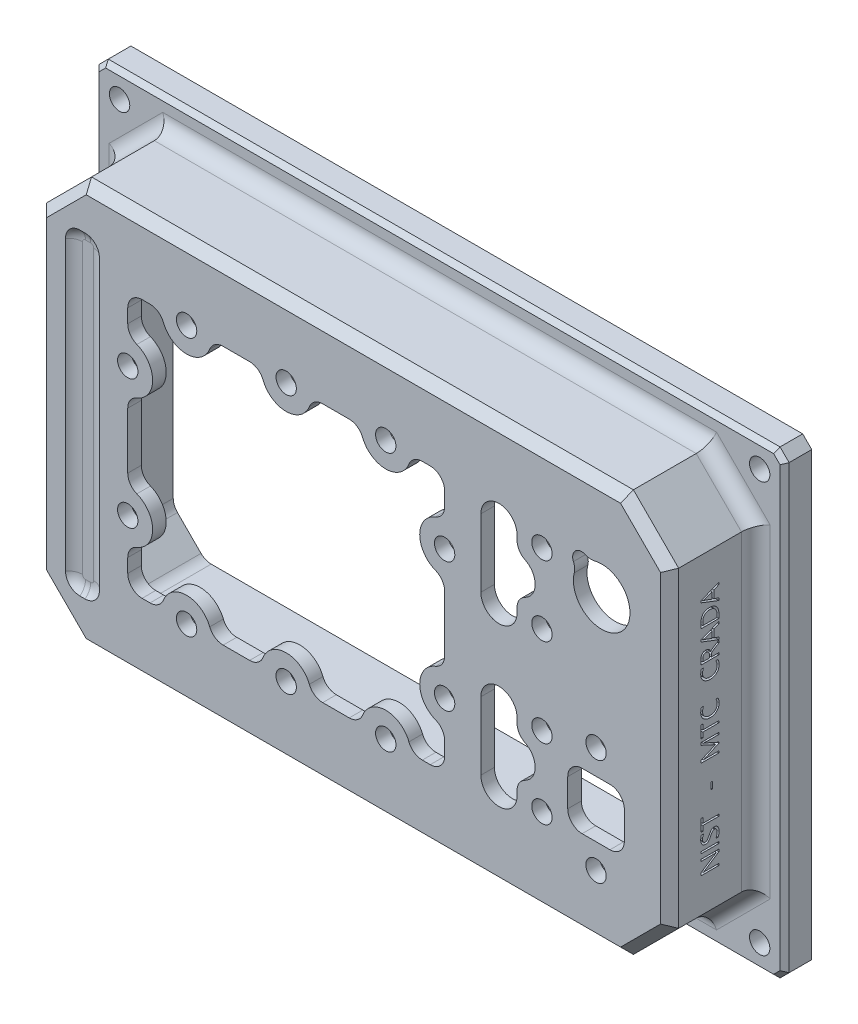
from build123d import *

# Parameters (mm, degrees)
SKETCH1_W                            = 152.4
SKETCH1_H                            = 101.6
FLANGE_BASE_DEPTH                    = 6
COVER_EXTERIOR_DEPTH                 = 19.05
F_4X_CLEARANCE_HOLE_M4_FLANGE_D      = 4.5
COVER_INTERIOR_DEPTH                 = 22.05
WINDOW_COVER_DEPTH                   = 185.867040059
F_10X_CLEARANCE_HOLE_M4_WINDOW_D     = 4.5
SKETCH8_W                            = 7.5
SKETCH8_H                            = 70
GROOVE_TOP_COVER_DEPTH               = 1.25
SKETCH9_W                            = 12.5
SKETCH9_H                            = 12.5
PORTS_TOP_COVER_DEPTH                = 185.867040059
F_2X_CLEARANCE_HOLE_M4_PORT_SQUARE_D = 4.5
F_4X_CLEARANCE_HOLE_M4_PORT_SLOTS_D  = 4.5
FILLET_3_175MM_FLANGE_R              = 3.175
FILLET_3_175MM_WINDOW_R              = 3.175
FILLET_3_175MM_PORTS_R               = 3.175
FILLET_3_175MM_GROOVE_R              = 3.175
FILLET_3MM_COVER_INTERIOR_R          = 3.175
CHAMFER_2MM_SIZE                     = 2
CHAMFER_1MM_SIZE                     = 1
SKETCH13_W                           = 3.950146484
SKETCH13_H                           = 0.40514323
SKETCH13_W_2                         = 0.354500326
SKETCH13_H_2                         = 1.468644205
ENGRAVING_TEXT_DEPTH                 = 1.5


with BuildPart() as part:
    # Sketch1 → Flange, Base (new body)
    with BuildSketch(Plane.XY):
        with Locations((76.2, 50.8)):
            Rectangle(SKETCH1_W, SKETCH1_H)
    extrude(amount=FLANGE_BASE_DEPTH)

    # Sketch2 → Cover, Exterior (add)
    with BuildSketch(Plane.XY.offset(6)):
        Polygon((16.35, 95.25), (6.35, 85.25), (6.35, 16.35), (16.35, 6.35), (136.05, 6.35), (146.05, 16.35), (146.05, 85.25), (136.05, 95.25), align=None)
    extrude(amount=COVER_EXTERIOR_DEPTH)

    # 4X, Clearance Hole, M4, Flange (through all)
    with Locations(Plane.XY.offset(6)):
        with Locations((146.9, 5.5), (5.5, 5.5), (5.5, 96.1), (146.9, 96.1)):
            Hole(F_4X_CLEARANCE_HOLE_M4_FLANGE_D / 2)

    # Sketch5 → Cover, Interior (cut)
    with BuildSketch(Plane(origin=(0, 0, 0), x_dir=(-1, 0, 0), z_dir=(0, 0, -1))):
        Polygon((-11.35, 83.178932188), (-18.421067812, 90.25), (-133.978932188, 90.25), (-141.05, 83.178932188), (-141.05, 18.421067812), (-133.978932188, 11.35), (-18.421067812, 11.35), (-11.35, 18.421067812), align=None)
    extrude(amount=-COVER_INTERIOR_DEPTH, mode=Mode.SUBTRACT)

    # Sketch6 → Window, Cover (cut, through all)
    with BuildSketch(Plane.XY.offset(25.05)):
        with BuildLine():
            Line((26.35, 79.375), (33.85, 79.375))
            ThreePointArc((33.85, 79.375), (39.35, 73.875), (44.85, 79.375))
            Line((44.85, 79.375), (55.85, 79.375))
            ThreePointArc((55.85, 79.375), (61.35, 73.875), (66.85, 79.375))
            Line((66.85, 79.375), (77.85, 79.375))
            ThreePointArc((77.85, 79.375), (83.35, 73.875), (88.85, 79.375))
            Line((88.85, 79.375), (96.35, 79.375))
            Line((96.35, 79.375), (96.35, 70.5875))
            ThreePointArc((96.35, 70.5875), (90.85, 65.0875), (96.35, 59.5875))
            Line((96.35, 59.5875), (96.35, 42.0125))
            ThreePointArc((96.35, 42.0125), (90.85, 36.5125), (96.35, 31.0125))
            Line((96.35, 31.0125), (96.35, 22.225))
            Line((96.35, 22.225), (88.85, 22.225))
            ThreePointArc((88.85, 22.225), (83.35, 27.725), (77.85, 22.225))
            Line((77.85, 22.225), (66.85, 22.225))
            ThreePointArc((66.85, 22.225), (61.35, 27.725), (55.85, 22.225))
            Line((55.85, 22.225), (44.85, 22.225))
            ThreePointArc((44.85, 22.225), (39.35, 27.725), (33.85, 22.225))
            Line((33.85, 22.225), (26.35, 22.225))
            Line((26.35, 22.225), (26.35, 31.0125))
            ThreePointArc((26.35, 31.0125), (31.85, 36.5125), (26.35, 42.0125))
            Line((26.35, 42.0125), (26.35, 59.5875))
            ThreePointArc((26.35, 59.5875), (31.85, 65.0875), (26.35, 70.5875))
            Line((26.35, 70.5875), (26.35, 79.375))
        make_face()
    extrude(amount=-WINDOW_COVER_DEPTH, mode=Mode.SUBTRACT)

    # 10X, Clearance Hole, M4, Window (through all)
    with Locations(Plane(origin=(39.35, 22.225, 25.05), x_dir=(1, 0, 0), z_dir=(0, 0, 1))):
        with Locations((0, 0), (22, 0), (44, 0), (57, 14.2875), (57, 42.8625), (44, 57.15), (22, 57.15), (0, 57.15), (-13, 42.8625), (-13, 14.2875)):
            Hole(F_10X_CLEARANCE_HOLE_M4_WINDOW_D / 2)

    # Sketch8 → Groove, Top, Cover (cut)
    with BuildSketch(Plane.XY.offset(25.05)):
        with Locations((16.35, 50.8)):
            Rectangle(SKETCH8_W, SKETCH8_H)
    extrude(amount=-GROOVE_TOP_COVER_DEPTH, mode=Mode.SUBTRACT)

    # Sketch9 → Ports, Top, Cover (cut, through all)
    with BuildSketch(Plane.XY.offset(25.05)):
        with BuildLine():
            Line((112.35, 29.3), (112.35, 25.8))
            ThreePointArc((112.35, 25.8), (108.35, 21.8), (104.35, 25.8))
            Line((104.35, 25.8), (104.35, 40.8))
            ThreePointArc((104.35, 40.8), (108.35, 44.8), (112.35, 40.8))
            Line((112.35, 40.8), (112.35, 37.3))
            ThreePointArc((112.35, 37.3), (116.35, 33.3), (112.35, 29.3))
        make_face()
        with Locations((129.8, 32.05)):
            Rectangle(SKETCH9_W, SKETCH9_H)
        with BuildLine():
            Line((112.35, 75.8), (112.35, 72.3))
            ThreePointArc((112.35, 72.3), (116.35, 68.3), (112.35, 64.3))
            Line((112.35, 64.3), (112.35, 60.8))
            ThreePointArc((112.35, 60.8), (108.35, 56.8), (104.35, 60.8))
            Line((104.35, 60.8), (104.35, 75.8))
            ThreePointArc((104.35, 75.8), (108.35, 79.8), (112.35, 75.8))
        make_face()
        with BuildLine():
            ThreePointArc((125.460862518, 76.097148943), (135.469417382, 68.880582618), (128.252851057, 78.889137482))
            ThreePointArc((128.252851057, 78.889137482), (125.216369055, 79.133630945), (125.460862518, 76.097148943))
        make_face()
    extrude(amount=-PORTS_TOP_COVER_DEPTH, mode=Mode.SUBTRACT)

    # 2X, Clearance Hole, M4, Port, Square (through all)
    with Locations(Plane(origin=(129.8, 43.8, 25.05), x_dir=(1, 0, 0), z_dir=(0, 0, 1))):
        with Locations((0, 0), (0, -23.5)):
            Hole(F_2X_CLEARANCE_HOLE_M4_PORT_SQUARE_D / 2)

    # 4X, Clearance Hole, M4, Port, Slots (through all)
    with Locations(Plane(origin=(117.85, 76.045966692, 25.05), x_dir=(1, 0, 0), z_dir=(0, 0, 1))):
        with Locations((0, 0), (0, -15.491933384), (0, -35), (0, -50.491933384)):
            Hole(F_4X_CLEARANCE_HOLE_M4_PORT_SLOTS_D / 2)

    # Fillet, 3.175mm, Flange
    fillet_3_175mm_flange_edges = [part.edges().sort_by_distance(p)[0] for p in [
        (6.35, 50.8, 6),
        (11.35, 11.35, 6),
        (76.2, 6.35, 6),
        (141.05, 11.35, 6),
        (146.05, 50.8, 6),
        (141.05, 90.25, 6),
        (76.2, 95.25, 6),
        (11.35, 90.25, 6),
    ]]
    fillet(fillet_3_175mm_flange_edges, radius=FILLET_3_175MM_FLANGE_R)

    # Fillet, 3.175mm, Window
    fillet_3_175mm_window_edges = [part.edges().sort_by_distance(p)[0] for p in [
        (26.35, 79.375, 23.55),
        (33.85, 79.375, 23.55),
        (44.85, 79.375, 23.55),
        (55.85, 79.375, 23.55),
        (66.85, 79.375, 23.55),
        (77.85, 79.375, 23.55),
        (88.85, 79.375, 23.55),
        (96.35, 79.375, 23.55),
        (96.35, 70.5875, 23.55),
        (96.35, 59.5875, 23.55),
        (96.35, 42.0125, 23.55),
        (96.35, 31.0125, 23.55),
        (96.35, 22.225, 23.55),
        (88.85, 22.225, 23.55),
        (77.85, 22.225, 23.55),
        (66.85, 22.225, 23.55),
        (55.85, 22.225, 23.55),
        (44.85, 22.225, 23.55),
        (33.85, 22.225, 23.55),
        (26.35, 22.225, 23.55),
        (26.35, 31.0125, 23.55),
        (26.35, 42.0125, 23.55),
        (26.35, 59.5875, 23.55),
        (26.35, 70.5875, 23.55),
    ]]
    fillet(fillet_3_175mm_window_edges, radius=FILLET_3_175MM_WINDOW_R)

    # Fillet, 3.175mm, Ports
    fillet_3_175mm_ports_edges = [part.edges().sort_by_distance(p)[0] for p in [
        (12.6, 15.8, 24.425),
        (12.6, 85.8, 24.425),
        (20.1, 85.8, 24.425),
        (20.1, 15.8, 24.425),
        (123.55, 25.8, 23.55),
        (123.55, 38.3, 23.55),
        (136.05, 38.3, 23.55),
        (136.05, 25.8, 23.55),
        (125.460862518, 76.097148943, 23.55),
        (128.252851057, 78.889137482, 23.55),
        (112.35, 37.3, 23.55),
        (112.35, 29.3, 23.55),
        (112.35, 72.3, 23.55),
        (112.35, 64.3, 23.55),
    ]]
    fillet(fillet_3_175mm_ports_edges, radius=FILLET_3_175MM_PORTS_R)

    # Fillet, 3.175mm, Groove
    # the kernel refuses this fillet: 3.175 mm, written as the material it adds along each edge
    with BuildSketch(Plane(origin=(15.775, 82.625, 23.8), x_dir=(-1, 0, 0), z_dir=(0, -1, 0))) as fillet_3_175mm_groove_piece_1:
        with BuildLine():
            CenterArc((0.650123765, -3.175), FILLET_3_175MM_GROOVE_R, 37.322390296, 52.677609704)
            Line((0.650123765, 0), (0.650123765, 0.0635))
            Line((0.650123765, 0.0635), (3.175, 0.0635))
            Line((3.175, 0.0635), (3.2385, 0))
            ThreePointArc((3.2385, 0), (3.2385, -0.625), (3.225497525, -1.2115))
            Line((3.225497525, -1.2115), (3.175, -1.25))
        make_face()
    revolve(axis=Axis((15.775, 82.625, 23.8), (0, 0, -1)), revolution_arc=90)
    with BuildSketch(Plane(origin=(15.775, 85.8, 23.8), x_dir=(0, 0, 1), z_dir=(1, 0, 0)), Plane(origin=(16.925, 15.8, 23.8), x_dir=(0, 0, 1), z_dir=(-1, 0, 0))) as fillet_3_175mm_groove_piece_2:
        with BuildLine():
            CenterArc((3.175, 2.524876235), FILLET_3_175MM_GROOVE_R, 180, 52.677609704)
            Line((0, 2.524876235), (-0.0635, 2.524876235))
            Line((-0.0635, 2.524876235), (-0.0635, 0))
            Line((-0.0635, 0), (0, -0.0635))
            ThreePointArc((0, -0.0635), (0.625, -0.0635), (1.2115, -0.050497525))
            Line((1.2115, -0.050497525), (1.25, 0))
        make_face()
    extrude(amount=1.15)
    with BuildSketch(Plane(origin=(16.925, 82.625, 23.8), x_dir=(0, 1, 0), z_dir=(-1, 0, 0))) as fillet_3_175mm_groove_piece_3:
        with BuildLine():
            CenterArc((0.650123765, -3.175), FILLET_3_175MM_GROOVE_R, 37.322390296, 52.677609704)
            Line((0.650123765, 0), (0.650123765, 0.0635))
            Line((0.650123765, 0.0635), (3.175, 0.0635))
            Line((3.175, 0.0635), (3.2385, 0))
            ThreePointArc((3.2385, 0), (3.2385, -0.625), (3.225497525, -1.2115))
            Line((3.225497525, -1.2115), (3.175, -1.25))
        make_face()
    revolve(axis=Axis((16.925, 82.625, 23.8), (0, 0, -1)), revolution_arc=90)
    with BuildSketch(Plane(origin=(20.1, 82.625, 23.8), x_dir=(0, 0, 1), z_dir=(0, -1, 0)), Plane(origin=(12.6, 18.975, 23.8), x_dir=(0, 0, 1), z_dir=(0, 1, 0))) as fillet_3_175mm_groove_piece_4:
        with BuildLine():
            CenterArc((3.175, 2.524876235), FILLET_3_175MM_GROOVE_R, 180, 52.677609704)
            Line((0, 2.524876235), (-0.0635, 2.524876235))
            Line((-0.0635, 2.524876235), (-0.0635, 0))
            Line((-0.0635, 0), (0, -0.0635))
            ThreePointArc((0, -0.0635), (0.625, -0.0635), (1.2115, -0.050497525))
            Line((1.2115, -0.050497525), (1.25, 0))
        make_face()
    extrude(amount=63.65)
    with BuildSketch(Plane(origin=(16.925, 18.975, 23.8), x_dir=(0, -1, 0), z_dir=(-1, 0, 0))) as fillet_3_175mm_groove_piece_5:
        with BuildLine():
            CenterArc((0.650123765, 3.175), FILLET_3_175MM_GROOVE_R, 270, 52.677609704)
            Line((0.650123765, 0), (0.650123765, -0.0635))
            Line((0.650123765, -0.0635), (3.175, -0.0635))
            Line((3.175, -0.0635), (3.2385, 0))
            ThreePointArc((3.2385, 0), (3.2385, 0.625), (3.225497525, 1.2115))
            Line((3.225497525, 1.2115), (3.175, 1.25))
        make_face()
    revolve(axis=Axis((16.925, 18.975, 23.8), (0, 0, 1)), revolution_arc=90)
    with BuildSketch(Plane(origin=(15.775, 18.975, 23.8), x_dir=(-1, 0, 0), z_dir=(0, 1, 0))) as fillet_3_175mm_groove_piece_6:
        with BuildLine():
            CenterArc((0.650123765, 3.175), FILLET_3_175MM_GROOVE_R, 270, 52.677609704)
            Line((0.650123765, 0), (0.650123765, -0.0635))
            Line((0.650123765, -0.0635), (3.175, -0.0635))
            Line((3.175, -0.0635), (3.2385, 0))
            ThreePointArc((3.2385, 0), (3.2385, 0.625), (3.225497525, 1.2115))
            Line((3.225497525, 1.2115), (3.175, 1.25))
        make_face()
    revolve(axis=Axis((15.775, 18.975, 23.8), (0, 0, 1)), revolution_arc=90)

    # Fillet, 3mm, Cover, Interior
    fillet_3mm_cover_interior_edges = [part.edges().sort_by_distance(p)[0] for p in [
        (14.885533906, 86.714466094, 22.05),
        (18.421067812, 90.25, 11.025),
        (76.2, 90.25, 22.05),
        (133.978932188, 90.25, 11.025),
        (137.514466094, 86.714466094, 22.05),
        (141.05, 83.178932188, 11.025),
        (141.05, 50.8, 22.05),
        (141.05, 18.421067812, 11.025),
        (137.514466094, 14.885533906, 22.05),
        (133.978932188, 11.35, 11.025),
        (76.2, 11.35, 22.05),
        (18.421067812, 11.35, 11.025),
        (14.885533906, 14.885533906, 22.05),
        (11.35, 18.421067812, 11.025),
        (11.35, 50.8, 22.05),
        (11.35, 83.178932188, 11.025),
    ]]
    fillet(fillet_3mm_cover_interior_edges, radius=FILLET_3MM_COVER_INTERIOR_R)

    # Chamfer, 2mm
    chamfer_2mm_edges = [part.edges().sort_by_distance(p)[0] for p in [
        (6.35, 50.8, 25.05),
        (11.35, 11.35, 25.05),
        (76.2, 6.35, 25.05),
        (141.05, 11.35, 25.05),
        (146.05, 50.8, 25.05),
        (141.05, 90.25, 25.05),
        (76.2, 95.25, 25.05),
        (11.35, 90.25, 25.05),
        (0, 101.6, 3),
        (152.4, 101.6, 3),
        (152.4, 0, 3),
        (0, 0, 3),
    ]]
    chamfer(chamfer_2mm_edges, length=CHAMFER_2MM_SIZE)

    # Chamfer, 1mm
    chamfer_1mm_edges = [part.edges().sort_by_distance(p)[0] for p in [
        (76.2, 101.6, 6),
        (152.4, 50.8, 6),
        (0, 50.8, 6),
        (76.2, 0, 6),
        (1, 100.6, 6),
        (1, 1, 6),
        (151.4, 1, 6),
        (151.4, 100.6, 6),
    ]]
    chamfer(chamfer_1mm_edges, length=CHAMFER_1MM_SIZE)

    # Sketch13 → Engraving, Text (cut)
    # profile 1 of 13: a face of its own
    with BuildSketch(Plane(origin=(146.05, 0, 0), x_dir=(0, 0, -1), z_dir=(1, 0, 0))):
        with BuildLine():
            Line((-14.175, 27.073799642), (-14.175, 26.564205424))
            Line((-14.175, 26.564205424), (-17.371041997, 24.464898809))
            add(Edge.make_bspline(
                [(-17.371041997, 24.464898809), (-17.388589714, 24.453870112), (-17.424929386, 24.431030718), (-17.48415208, 24.399685499), (-17.548669603, 24.367599326), (-17.594842121, 24.348802492), (-17.618717448, 24.339082845)],
                knots=[0, 0, 0, 0, 0.893627632, 1.850618776, 2.888577403, 4, 4, 4, 4], degree=3))
            Line((-17.618717448, 24.339082845), (-17.618717448, 24.325630824))
            add(Edge.make_bspline(
                [(-17.618717448, 24.325630824), (-17.604743432, 24.326773789), (-17.574449742, 24.329251578), (-17.52508303, 24.331264536), (-17.468377362, 24.333672764), (-17.40429263, 24.336190579), (-17.333066533, 24.337721066), (-17.254721138, 24.338227085), (-17.169000344, 24.339328483), (-17.10938741, 24.339167104), (-17.078262711, 24.339082845)],
                knots=[0, 0, 0, 0, 0.622216159, 1.348876676, 2.192485707, 3.141373248, 4.195230468, 5.354246407, 6.618617129, 8, 8, 8, 8], degree=3))
            Line((-17.078262711, 24.339082845), (-14.175, 24.339082845))
            Line((-14.175, 24.339082845), (-14.175, 23.933939616))
            Line((-14.175, 23.933939616), (-18.125146484, 23.933939616))
            Line((-18.125146484, 23.933939616), (-18.125146484, 24.491011556))
            Line((-18.125146484, 24.491011556), (-14.991616821, 26.527014542))
            add(Edge.make_bspline(
                [(-14.991616821, 26.527014542), (-14.974421848, 26.53801422), (-14.941820282, 26.558869543), (-14.896419664, 26.589601485), (-14.854936187, 26.614084573), (-14.820203772, 26.636952933), (-14.790392768, 26.654734651), (-14.766097706, 26.669162568), (-14.747818732, 26.680588919), (-14.736598389, 26.685618497), (-14.73207194, 26.687647502)],
                knots=[0, 0, 0, 0, 1.604255624, 3.041658944, 4.307369394, 5.388506731, 6.30929538, 7.034544353, 7.610521251, 8, 8, 8, 8], degree=3))
            Line((-14.73207194, 26.687647502), (-14.73207194, 26.697934341))
            add(Edge.make_bspline(
                [(-14.73207194, 26.697934341), (-14.749460073, 26.6953841), (-14.785991586, 26.690026181), (-14.843910572, 26.68526906), (-14.907646758, 26.679012669), (-14.977621476, 26.675618038), (-15.053582344, 26.67241163), (-15.135351728, 26.66979042), (-15.223204182, 26.669535525), (-15.28386917, 26.668956167), (-15.315256627, 26.668656413)],
                knots=[0, 0, 0, 0, 0.721552806, 1.515942873, 2.3858434, 3.351444354, 4.392253989, 5.508461052, 6.710902694, 8, 8, 8, 8], degree=3))
            Line((-15.315256627, 26.668656413), (-18.125146484, 26.668656413))
            Line((-18.125146484, 26.668656413), (-18.125146484, 27.073799642))
            Line((-18.125146484, 27.073799642), (-14.175, 27.073799642))
        make_face()
    # profile 2 of 13: a face of its own
    with BuildSketch(Plane(origin=(146.05, 0, 0), x_dir=(0, 0, -1), z_dir=(1, 0, 0))):
        with Locations((-16.150073242, 28.339872233)):
            Rectangle(SKETCH13_W, SKETCH13_H)
    # profile 3 of 13: a face of its own
    with BuildSketch(Plane(origin=(146.05, 0, 0), x_dir=(0, 0, -1), z_dir=(1, 0, 0))):
        with BuildLine():
            add(Edge.make_bspline(
                [(-14.833357747, 29.454016113), (-14.810933215, 29.486506579), (-14.763956114, 29.55457078), (-14.706896104, 29.670858063), (-14.655103932, 29.801833387), (-14.611654546, 29.944962869), (-14.576408554, 30.093102879), (-14.548526409, 30.238412452), (-14.533370374, 30.378452827), (-14.530770621, 30.469744721), (-14.529500326, 30.514351908)],
                knots=[0, 0, 0, 0, 0.846452964, 1.773232316, 2.77208296, 3.868154266, 4.980527569, 6.039981904, 7.042292891, 8, 8, 8, 8], degree=3))
            add(Edge.make_bspline(
                [(-14.529500326, 30.514351908), (-14.529932958, 30.54918075), (-14.530772967, 30.61680519), (-14.537884397, 30.714827501), (-14.549726722, 30.806238468), (-14.565751656, 30.891075443), (-14.588244435, 30.968648297), (-14.614108788, 31.039815038), (-14.645118857, 31.104206065), (-14.680413084, 31.162635859), (-14.72192519, 31.213220322), (-14.767510829, 31.25780775), (-14.818490315, 31.294678811), (-14.873592448, 31.326351419), (-14.93419142, 31.349963642), (-14.999385357, 31.366150421), (-15.069063692, 31.377055289), (-15.11712471, 31.377972455), (-15.141962941, 31.378446452)],
                knots=[0, 0, 0, 0, 1.387448694, 2.693900732, 3.912587258, 5.058421495, 6.129439662, 7.12689455, 8.071586665, 8.972727521, 9.839260954, 10.671605474, 11.506003778, 12.338878791, 13.197475128, 14.086960817, 15.011329513, 16, 16, 16, 16], degree=3))
            add(Edge.make_bspline(
                [(-15.141962941, 31.378446452), (-15.170552039, 31.377524481), (-15.226446856, 31.375721926), (-15.307439123, 31.357364203), (-15.383359626, 31.329073903), (-15.453190916, 31.288851535), (-15.517386169, 31.239754082), (-15.577811618, 31.184613888), (-15.63264508, 31.12143875), (-15.674480676, 31.062183057), (-15.709149177, 31.007601944), (-15.738849418, 30.956183992), (-15.772947416, 30.89487976), (-15.811636231, 30.824016627), (-15.854132814, 30.743038313), (-15.901963249, 30.652887814), (-15.953278615, 30.552322804), (-15.988449076, 30.481676885), (-16.00684878, 30.444717916)],
                knots=[0, 0, 0, 0, 1.01667817, 1.987717208, 2.942073005, 3.892862143, 4.845413119, 5.816043117, 6.801381151, 7.818059321, 8.396609255, 9.103907621, 9.93239023, 10.895032119, 11.979212488, 13.189395744, 14.529610242, 16, 16, 16, 16], degree=3))
            add(Edge.make_bspline(
                [(-16.00684878, 30.444717916), (-16.030104599, 30.400024383), (-16.075108536, 30.313534847), (-16.143829241, 30.19022682), (-16.211024945, 30.077308349), (-16.277553522, 29.97534392), (-16.341991202, 29.883362577), (-16.40555286, 29.802426137), (-16.466855116, 29.73138867), (-16.528627141, 29.671143412), (-16.591476259, 29.619284128), (-16.657156035, 29.574992684), (-16.726647106, 29.537103598), (-16.80043456, 29.507508848), (-16.877681039, 29.483516884), (-16.958664543, 29.46608937), (-17.043693702, 29.455577618), (-17.101707379, 29.454543333), (-17.1312795, 29.454016113)],
                knots=[0, 0, 0, 0, 1.518393315, 2.938347519, 4.253975348, 5.477722369, 6.60701253, 7.63752037, 8.578296998, 9.432795184, 10.234877336, 11.030829842, 11.816915694, 12.615563126, 13.422711235, 14.252216256, 15.109077795, 16, 16, 16, 16], degree=3))
            add(Edge.make_bspline(
                [(-17.1312795, 29.454016113), (-17.170376821, 29.455290455), (-17.247159552, 29.457793117), (-17.359301026, 29.475734419), (-17.464794333, 29.508148247), (-17.564140347, 29.551488717), (-17.657402834, 29.607695618), (-17.743571337, 29.677128499), (-17.824187678, 29.758474395), (-17.896862196, 29.851669512), (-17.962293599, 29.953524051), (-18.019228834, 30.06219342), (-18.067794261, 30.176742549), (-18.107211714, 30.2972403), (-18.138006173, 30.423440307), (-18.16035588, 30.55535747), (-18.172727788, 30.693210907), (-18.174756756, 30.787061707), (-18.175789388, 30.834826533)],
                knots=[0, 0, 0, 0, 0.969222899, 1.903444508, 2.805387991, 3.698421643, 4.584388408, 5.496374487, 6.43504833, 7.417526811, 8.420615585, 9.432680486, 10.455337492, 11.501700351, 12.572262804, 13.673113267, 14.815744348, 16, 16, 16, 16], degree=3))
            add(Edge.make_bspline(
                [(-18.175789388, 30.834826533), (-18.175368358, 30.882313824), (-18.174556193, 30.973916575), (-18.167407228, 31.106179531), (-18.155791191, 31.228193202), (-18.139475989, 31.339718103), (-18.11833649, 31.440779871), (-18.092259557, 31.531241786), (-18.062393289, 31.611831152), (-18.036269125, 31.659609925), (-18.023860677, 31.682303874)],
                knots=[0, 0, 0, 0, 1.310121745, 2.52721841, 3.653248466, 4.690686254, 5.635577584, 6.499266339, 7.287181937, 8, 8, 8, 8], degree=3))
            Line((-18.023860677, 31.682303874), (-17.517431641, 31.682303874))
            add(Edge.make_bspline(
                [(-17.517431641, 31.682303874), (-17.537839984, 31.652620387), (-17.579054471, 31.592674821), (-17.629910472, 31.494670833), (-17.673639074, 31.390689773), (-17.709311008, 31.280020993), (-17.736815731, 31.162758963), (-17.756392587, 31.038987208), (-17.768527478, 30.908659859), (-17.769928336, 30.819555405), (-17.770646159, 30.77389679)],
                knots=[0, 0, 0, 0, 0.901025016, 1.819612908, 2.757737419, 3.722440357, 4.726625466, 5.769822488, 6.857219657, 8, 8, 8, 8], degree=3))
            add(Edge.make_bspline(
                [(-17.770646159, 30.77389679), (-17.770326526, 30.742746795), (-17.769702404, 30.681922676), (-17.760861693, 30.593017325), (-17.750208557, 30.508115863), (-17.731142316, 30.428319918), (-17.709541667, 30.352359489), (-17.681498253, 30.281080749), (-17.649234219, 30.213743125), (-17.612360565, 30.151172619), (-17.5704618, 30.094904424), (-17.524356402, 30.045450377), (-17.474419138, 30.003039891), (-17.420270677, 29.968854026), (-17.362240552, 29.942289567), (-17.300540796, 29.9233895), (-17.234819073, 29.912135261), (-17.189879556, 29.910591869), (-17.166887792, 29.909802246)],
                knots=[0, 0, 0, 0, 1.266297591, 2.472598641, 3.631705049, 4.742959013, 5.805451407, 6.84139923, 7.853805457, 8.839952818, 9.790444434, 10.701239882, 11.584450425, 12.447560658, 13.297232265, 14.172721029, 15.065135306, 16, 16, 16, 16], degree=3))
            add(Edge.make_bspline(
                [(-17.166887792, 29.909802246), (-17.14602841, 29.910200522), (-17.104943387, 29.910984973), (-17.044970322, 29.918855832), (-16.988163674, 29.93272417), (-16.934088852, 29.950552213), (-16.883000685, 29.974730404), (-16.834885667, 30.003757216), (-16.78997194, 30.038470229), (-16.74681253, 30.079089545), (-16.704437752, 30.128988194), (-16.659330989, 30.188287272), (-16.612047684, 30.259578617), (-16.560712258, 30.341397337), (-16.507052405, 30.434935247), (-16.45105021, 30.540057581), (-16.390768859, 30.655797061), (-16.35111308, 30.737654227), (-16.330488586, 30.780227153)],
                knots=[0, 0, 0, 0, 0.77990353, 1.536112407, 2.256331255, 2.964490532, 3.661778373, 4.365595399, 5.062115187, 5.780913816, 6.578095787, 7.507405743, 8.566283842, 9.776155305, 11.119691656, 12.598303188, 14.230818451, 16, 16, 16, 16], degree=3))
            add(Edge.make_bspline(
                [(-16.330488586, 30.780227153), (-16.305396178, 30.829931475), (-16.256899793, 30.925995586), (-16.183105353, 31.062937508), (-16.109231477, 31.186439727), (-16.037577556, 31.297785588), (-15.966104758, 31.396192895), (-15.89635756, 31.482794372), (-15.826576668, 31.555942119), (-15.757573103, 31.617158271), (-15.688200775, 31.66860834), (-15.618150086, 31.712930722), (-15.546487037, 31.749989361), (-15.474257649, 31.781970445), (-15.399502465, 31.803939278), (-15.32413714, 31.822070621), (-15.246975265, 31.832572361), (-15.195009808, 31.833676908), (-15.168866984, 31.834232585)],
                knots=[0, 0, 0, 0, 1.609612237, 3.110915983, 4.495779321, 5.768997548, 6.937314625, 8.010323223, 8.981086609, 9.856220565, 10.673642867, 11.475445225, 12.249651958, 13.004580809, 13.7546806, 14.498240735, 15.244493736, 16, 16, 16, 16], degree=3))
            add(Edge.make_bspline(
                [(-15.168866984, 31.834232585), (-15.127920237, 31.833281482), (-15.048008594, 31.831425311), (-14.931706582, 31.813675962), (-14.822918044, 31.784412665), (-14.720909325, 31.744156898), (-14.627629436, 31.690459757), (-14.540567699, 31.62671969), (-14.462365543, 31.549880968), (-14.39095832, 31.462600433), (-14.327899286, 31.365044079), (-14.27287667, 31.2582865), (-14.22763972, 31.142400447), (-14.189123942, 31.01824335), (-14.160402952, 30.884711369), (-14.139162069, 30.742542974), (-14.126284111, 30.591345506), (-14.125011734, 30.487737438), (-14.124357096, 30.434431076)],
                knots=[0, 0, 0, 0, 0.994507712, 1.940880566, 2.850463274, 3.727671945, 4.597425683, 5.458897333, 6.342801193, 7.253783017, 8.194255203, 9.160327251, 10.167274234, 11.213441525, 12.316068275, 13.482711842, 14.704854983, 16, 16, 16, 16], degree=3))
            add(Edge.make_bspline(
                [(-14.124357096, 30.434431076), (-14.125362457, 30.397754614), (-14.127506518, 30.319537317), (-14.13770839, 30.19554915), (-14.157940684, 30.058549372), (-14.181702535, 29.913728043), (-14.21092322, 29.772750168), (-14.24462, 29.647075453), (-14.280997691, 29.54168568), (-14.312569577, 29.481423714), (-14.326928711, 29.454016113)],
                knots=[0, 0, 0, 0, 0.873131826, 1.862066528, 2.958468332, 4.167984308, 5.354840096, 6.382754451, 7.264464431, 8, 8, 8, 8], degree=3))
            Line((-14.326928711, 29.454016113), (-14.833357747, 29.454016113))
        make_face()
    # profile 4 of 13: a face of its own
    with BuildSketch(Plane(origin=(146.05, 0, 0), x_dir=(0, 0, -1), z_dir=(1, 0, 0))):
        Polygon((-17.720003255, 34.872806803), (-17.720003255, 33.758662923), (-14.175, 33.758662923), (-14.175, 33.353519694), (-17.720003255, 33.353519694), (-17.720003255, 32.239375814), (-18.125146484, 32.239375814), (-18.125146484, 34.872806803), align=None)
    # profile 5 of 13: a face of its own
    with BuildSketch(Plane(origin=(146.05, 0, 0), x_dir=(0, 0, -1), z_dir=(1, 0, 0))):
        with Locations((-15.719608561, 40.013061523)):
            Rectangle(SKETCH13_W_2, SKETCH13_H_2)
    # profile 6 of 13: a face of its own
    with BuildSketch(Plane(origin=(146.05, 0, 0), x_dir=(0, 0, -1), z_dir=(1, 0, 0))):
        with BuildLine():
            Line((-14.175, 49.002176921), (-16.853534826, 49.002176921))
            add(Edge.make_bspline(
                [(-16.853534826, 49.002176921), (-16.908144, 49.002609629), (-17.023744519, 49.003525616), (-17.205991953, 49.012579872), (-17.406554663, 49.023755705), (-17.545943642, 49.035572329), (-17.618717448, 49.041741689)],
                knots=[0, 0, 0, 0, 0.854969074, 1.809858303, 2.856545566, 4, 4, 4, 4], degree=3))
            Line((-17.618717448, 49.041741689), (-17.618717448, 49.029080963))
            add(Edge.make_bspline(
                [(-17.618717448, 49.029080963), (-17.577531546, 49.01868282), (-17.501533177, 48.999495626), (-17.397688541, 48.971002507), (-17.313988983, 48.942749077), (-17.265711074, 48.922483145), (-17.244434738, 48.913551839)],
                knots=[0, 0, 0, 0, 1.299717072, 2.398305537, 3.294124607, 4, 4, 4, 4], degree=3))
            Line((-17.244434738, 48.913551839), (-14.175, 47.533532715))
            Line((-14.175, 47.533532715), (-14.175, 47.3309611))
            Line((-14.175, 47.3309611), (-17.222278468, 45.973889542))
            add(Edge.make_bspline(
                [(-17.222278468, 45.973889542), (-17.244834805, 45.964570686), (-17.296245118, 45.943331187), (-17.385709287, 45.916905953), (-17.495419767, 45.889475551), (-17.575406795, 45.871856889), (-17.618717448, 45.862316895)],
                knots=[0, 0, 0, 0, 0.709636107, 1.617399769, 2.709891152, 4, 4, 4, 4], degree=3))
            Line((-17.618717448, 45.862316895), (-17.618717448, 45.848864873))
            add(Edge.make_bspline(
                [(-17.618717448, 45.848864873), (-17.60395228, 45.850019408), (-17.569709595, 45.852696952), (-17.511102218, 45.854527637), (-17.438047057, 45.857015911), (-17.350743821, 45.859452297), (-17.248923713, 45.860978131), (-17.132598042, 45.861472026), (-17.001772434, 45.862565246), (-16.909717077, 45.862402323), (-16.861447779, 45.862316895)],
                knots=[0, 0, 0, 0, 0.469167865, 1.088072123, 1.857297772, 2.785230927, 3.855019937, 5.083484229, 6.470722694, 8, 8, 8, 8], degree=3))
            Line((-16.861447779, 45.862316895), (-14.175, 45.862316895))
            Line((-14.175, 45.862316895), (-14.175, 45.457173665))
            Line((-14.175, 45.457173665), (-18.125146484, 45.457173665))
            Line((-18.125146484, 45.457173665), (-18.125146484, 46.014245605))
            Line((-18.125146484, 46.014245605), (-15.350073624, 47.236796951))
            add(Edge.make_bspline(
                [(-15.350073624, 47.236796951), (-15.322936662, 47.248738337), (-15.271136023, 47.271532759), (-15.196342975, 47.303103615), (-15.128542921, 47.331952716), (-15.066789474, 47.356012786), (-15.012237008, 47.377948756), (-14.963755816, 47.3950599), (-14.92204747, 47.409819355), (-14.89590895, 47.417072883), (-14.884000651, 47.420377477)],
                knots=[0, 0, 0, 0, 1.419480801, 2.70958896, 3.886975172, 4.946959844, 5.882678436, 6.701599585, 7.408469151, 8, 8, 8, 8], degree=3))
            Line((-14.884000651, 47.420377477), (-14.884000651, 47.436203384))
            add(Edge.make_bspline(
                [(-14.884000651, 47.436203384), (-14.894551654, 47.440158518), (-14.918313219, 47.449065743), (-14.958025003, 47.463990012), (-15.005653729, 47.483277771), (-15.061307864, 47.505961473), (-15.124980937, 47.532460797), (-15.197187191, 47.561517569), (-15.277305033, 47.594652583), (-15.333458285, 47.617933177), (-15.36273435, 47.63007075)],
                knots=[0, 0, 0, 0, 0.523561194, 1.179094775, 1.971078505, 2.911015028, 3.971606011, 5.175531673, 6.527434934, 8, 8, 8, 8], degree=3))
            Line((-15.36273435, 47.63007075), (-18.125146484, 48.900891113))
            Line((-18.125146484, 48.900891113), (-18.125146484, 49.40732015))
            Line((-18.125146484, 49.40732015), (-14.175, 49.40732015))
            Line((-14.175, 49.40732015), (-14.175, 49.002176921))
        make_face()
    # profile 7 of 13: a face of its own
    with BuildSketch(Plane(origin=(146.05, 0, 0), x_dir=(0, 0, -1), z_dir=(1, 0, 0))):
        Polygon((-17.720003255, 52.74975179), (-17.720003255, 51.63560791), (-14.175, 51.63560791), (-14.175, 51.230464681), (-17.720003255, 51.230464681), (-17.720003255, 50.116320801), (-18.125146484, 50.116320801), (-18.125146484, 52.74975179), align=None)
    # profile 8 of 13: a face of its own
    with BuildSketch(Plane(origin=(146.05, 0, 0), x_dir=(0, 0, -1), z_dir=(1, 0, 0))):
        with BuildLine():
            add(Edge.make_bspline(
                [(-14.377571615, 56.092183431), (-14.357146158, 56.055048141), (-14.315811117, 55.979897374), (-14.265068167, 55.85988637), (-14.221222288, 55.733583874), (-14.185879852, 55.600490943), (-14.158213003, 55.460930473), (-14.138608943, 55.31479285), (-14.126526759, 55.162088938), (-14.125089399, 55.057983122), (-14.124357096, 55.004943593)],
                knots=[0, 0, 0, 0, 0.900334108, 1.822008111, 2.765255698, 3.740339547, 4.746393174, 5.787454655, 6.872758841, 8, 8, 8, 8], degree=3))
            add(Edge.make_bspline(
                [(-14.124357096, 55.004943593), (-14.126045268, 54.937080709), (-14.129354972, 54.804033823), (-14.154792207, 54.609678202), (-14.197815989, 54.42557829), (-14.256718213, 54.251460978), (-14.334322409, 54.08784939), (-14.428886793, 53.934546228), (-14.54040749, 53.791358074), (-14.667571114, 53.659678093), (-14.808124138, 53.541153481), (-14.960269609, 53.437850355), (-15.121790341, 53.349757582), (-15.293623082, 53.277963961), (-15.475302108, 53.222810002), (-15.667058912, 53.183428078), (-15.868541845, 53.159215763), (-16.006252526, 53.156354313), (-16.076482773, 53.15489502)],
                knots=[0, 0, 0, 0, 1.076510139, 2.110525129, 3.103305145, 4.072058517, 5.021160122, 5.970040267, 6.924349727, 7.895125778, 8.869269618, 9.83616817, 10.808089137, 11.783499633, 12.785620692, 13.815664692, 14.8860239, 16, 16, 16, 16], degree=3))
            add(Edge.make_bspline(
                [(-16.076482773, 53.15489502), (-16.150939031, 53.156515651), (-16.296897233, 53.15969261), (-16.510983276, 53.186165899), (-16.714761227, 53.230663454), (-16.909160299, 53.291165485), (-17.092917845, 53.371060249), (-17.267091005, 53.468008173), (-17.431524401, 53.582423084), (-17.584456436, 53.713387135), (-17.723040218, 53.857960494), (-17.84455842, 54.014226649), (-17.947054229, 54.180862984), (-18.030284581, 54.358138479), (-18.09691954, 54.544696148), (-18.141855658, 54.742102924), (-18.170547348, 54.949237044), (-18.17401636, 55.090832567), (-18.175789388, 55.163202667)],
                knots=[0, 0, 0, 0, 1.096715353, 2.149914661, 3.172078793, 4.166382941, 5.144578477, 6.11878275, 7.098705866, 8.09093464, 9.080420004, 10.044299692, 11.002057351, 11.956403068, 12.924924898, 13.914684945, 14.934186224, 16, 16, 16, 16], degree=3))
            add(Edge.make_bspline(
                [(-18.175789388, 55.163202667), (-18.175350193, 55.208843487), (-18.174489018, 55.298336114), (-18.167263944, 55.429533347), (-18.155505397, 55.554938455), (-18.139028113, 55.674305756), (-18.117823307, 55.787651173), (-18.091549026, 55.894848851), (-18.061296734, 55.996291775), (-18.036158658, 56.060682418), (-18.023860677, 56.092183431)],
                knots=[0, 0, 0, 0, 1.156489919, 2.267648153, 3.328454044, 4.347437676, 5.320124273, 6.249019161, 7.143389983, 8, 8, 8, 8], degree=3))
            Line((-18.023860677, 56.092183431), (-17.568074544, 56.092183431))
            add(Edge.make_bspline(
                [(-17.568074544, 56.092183431), (-17.584362887, 56.056770458), (-17.617014033, 55.985782623), (-17.657682785, 55.875622893), (-17.692798849, 55.76289673), (-17.721228776, 55.647139724), (-17.743408967, 55.528253249), (-17.759048812, 55.406463022), (-17.768886005, 55.281795844), (-17.770055047, 55.197774256), (-17.770646159, 55.155289714)],
                knots=[0, 0, 0, 0, 0.96749784, 1.939418551, 2.912992658, 3.897779793, 4.897093106, 5.91410379, 6.945290764, 8, 8, 8, 8], degree=3))
            add(Edge.make_bspline(
                [(-17.770646159, 55.155289714), (-17.769436488, 55.097707844), (-17.767074204, 54.985260157), (-17.744018675, 54.821300745), (-17.708342915, 54.666201059), (-17.656345349, 54.520408373), (-17.590428794, 54.383433851), (-17.509986554, 54.255065363), (-17.414571624, 54.135679984), (-17.304403683, 54.027266392), (-17.183803977, 53.929081868), (-17.053248334, 53.844302841), (-16.914941129, 53.772001013), (-16.768569719, 53.712208744), (-16.613714316, 53.666396369), (-16.450507385, 53.634370273), (-16.279311776, 53.613911692), (-16.162266109, 53.611771987), (-16.10259552, 53.610681152)],
                knots=[0, 0, 0, 0, 1.079614412, 2.10830501, 3.09967663, 4.060610912, 5.005602913, 5.946036828, 6.89654438, 7.865736758, 8.840219802, 9.809159523, 10.780774066, 11.763961821, 12.770626558, 13.805084693, 14.881018901, 16, 16, 16, 16], degree=3))
            add(Edge.make_bspline(
                [(-16.10259552, 53.610681152), (-16.045574552, 53.611919692), (-15.933872065, 53.614345957), (-15.770515918, 53.63265854), (-15.615290492, 53.663344875), (-15.46858512, 53.706954648), (-15.329802154, 53.762413283), (-15.199701814, 53.830699543), (-15.077685738, 53.91117889), (-14.964864293, 54.003349816), (-14.863151779, 54.106263694), (-14.772473482, 54.216874205), (-14.698353186, 54.337856779), (-14.63572791, 54.465495903), (-14.588646241, 54.602296213), (-14.55327126, 54.746508331), (-14.533845339, 54.899700968), (-14.530971784, 55.0043651), (-14.529500326, 55.057960383)],
                knots=[0, 0, 0, 0, 1.137162008, 2.227668694, 3.273886737, 4.289279499, 5.275999999, 6.250243084, 7.214749633, 8.186802671, 9.150318664, 10.096851242, 11.032620065, 11.973815561, 12.927224262, 13.912316463, 14.930961451, 16, 16, 16, 16], degree=3))
            add(Edge.make_bspline(
                [(-14.529500326, 55.057960383), (-14.530385005, 55.106792443), (-14.532129537, 55.203086153), (-14.546771283, 55.345088038), (-14.570355109, 55.482362376), (-14.603493978, 55.614690669), (-14.646395299, 55.741964681), (-14.69891385, 55.864116995), (-14.760131297, 55.981818051), (-14.808949948, 56.055396505), (-14.833357747, 56.092183431)],
                knots=[0, 0, 0, 0, 1.070106145, 2.110181118, 3.125275816, 4.120821421, 5.097094118, 6.065736613, 7.032928786, 8, 8, 8, 8], degree=3))
            Line((-14.833357747, 56.092183431), (-14.377571615, 56.092183431))
        make_face()
    # profile 9 of 13: a face of its own
    with BuildSketch(Plane(origin=(146.05, 0, 0), x_dir=(0, 0, -1), z_dir=(1, 0, 0))):
        with BuildLine():
            add(Edge.make_bspline(
                [(-14.377571615, 63.43540446), (-14.357146158, 63.39826917), (-14.315811117, 63.323118402), (-14.265068167, 63.203107398), (-14.221222288, 63.076804903), (-14.185879852, 62.943711972), (-14.158213003, 62.804151502), (-14.138608943, 62.658013879), (-14.126526759, 62.505309967), (-14.125089399, 62.40120415), (-14.124357096, 62.348164622)],
                knots=[0, 0, 0, 0, 0.900334108, 1.822008111, 2.765255698, 3.740339547, 4.746393174, 5.787454655, 6.872758841, 8, 8, 8, 8], degree=3))
            add(Edge.make_bspline(
                [(-14.124357096, 62.348164622), (-14.126045268, 62.280301738), (-14.129354972, 62.147254851), (-14.154792207, 61.952899231), (-14.197815989, 61.768799319), (-14.256718213, 61.594682007), (-14.334322409, 61.431070419), (-14.428886793, 61.277767256), (-14.54040749, 61.134579103), (-14.667571114, 61.002899122), (-14.808124138, 60.884374509), (-14.960269609, 60.781071384), (-15.121790341, 60.692978611), (-15.293623082, 60.62118499), (-15.475302108, 60.566031031), (-15.667058912, 60.526649106), (-15.868541845, 60.502436792), (-16.006252526, 60.499575342), (-16.076482773, 60.498116048)],
                knots=[0, 0, 0, 0, 1.076510139, 2.110525129, 3.103305145, 4.072058517, 5.021160122, 5.970040267, 6.924349727, 7.895125778, 8.869269618, 9.83616817, 10.808089137, 11.783499633, 12.785620692, 13.815664692, 14.8860239, 16, 16, 16, 16], degree=3))
            add(Edge.make_bspline(
                [(-16.076482773, 60.498116048), (-16.150939031, 60.49973668), (-16.296897233, 60.502913638), (-16.510983276, 60.529386927), (-16.714761227, 60.573884483), (-16.909160299, 60.634386514), (-17.092917845, 60.714281278), (-17.267091005, 60.811229202), (-17.431524401, 60.925644112), (-17.584456436, 61.056608164), (-17.723040218, 61.201181523), (-17.84455842, 61.357447678), (-17.947054229, 61.524084013), (-18.030284581, 61.701359508), (-18.09691954, 61.887917176), (-18.141855658, 62.085323953), (-18.170547348, 62.292458073), (-18.17401636, 62.434053596), (-18.175789388, 62.506423696)],
                knots=[0, 0, 0, 0, 1.096715353, 2.149914661, 3.172078793, 4.166382941, 5.144578477, 6.11878275, 7.098705866, 8.09093464, 9.080420004, 10.044299692, 11.002057351, 11.956403068, 12.924924898, 13.914684945, 14.934186224, 16, 16, 16, 16], degree=3))
            add(Edge.make_bspline(
                [(-18.175789388, 62.506423696), (-18.175350193, 62.552064516), (-18.174489018, 62.641557143), (-18.167263944, 62.772754376), (-18.155505397, 62.898159483), (-18.139028113, 63.017526784), (-18.117823307, 63.130872202), (-18.091549026, 63.23806988), (-18.061296734, 63.339512803), (-18.036158658, 63.403903447), (-18.023860677, 63.43540446)],
                knots=[0, 0, 0, 0, 1.156489919, 2.267648153, 3.328454044, 4.347437676, 5.320124273, 6.249019161, 7.143389983, 8, 8, 8, 8], degree=3))
            Line((-18.023860677, 63.43540446), (-17.568074544, 63.43540446))
            add(Edge.make_bspline(
                [(-17.568074544, 63.43540446), (-17.584362887, 63.399991486), (-17.617014033, 63.329003651), (-17.657682785, 63.218843922), (-17.692798849, 63.106117759), (-17.721228776, 62.990360753), (-17.743408967, 62.871474278), (-17.759048812, 62.74968405), (-17.768886005, 62.625016873), (-17.770055047, 62.540995284), (-17.770646159, 62.498510742)],
                knots=[0, 0, 0, 0, 0.96749784, 1.939418551, 2.912992658, 3.897779793, 4.897093106, 5.91410379, 6.945290764, 8, 8, 8, 8], degree=3))
            add(Edge.make_bspline(
                [(-17.770646159, 62.498510742), (-17.769436488, 62.440928873), (-17.767074204, 62.328481186), (-17.744018675, 62.164521774), (-17.708342915, 62.009422087), (-17.656345349, 61.863629402), (-17.590428794, 61.726654879), (-17.509986554, 61.598286392), (-17.414571624, 61.478901013), (-17.304403683, 61.370487421), (-17.183803977, 61.272302897), (-17.053248334, 61.18752387), (-16.914941129, 61.115222041), (-16.768569719, 61.055429773), (-16.613714316, 61.009617398), (-16.450507385, 60.977591302), (-16.279311776, 60.95713272), (-16.162266109, 60.954993015), (-16.10259552, 60.953902181)],
                knots=[0, 0, 0, 0, 1.079614412, 2.10830501, 3.09967663, 4.060610912, 5.005602913, 5.946036828, 6.89654438, 7.865736758, 8.840219802, 9.809159523, 10.780774066, 11.763961821, 12.770626558, 13.805084693, 14.881018901, 16, 16, 16, 16], degree=3))
            add(Edge.make_bspline(
                [(-16.10259552, 60.953902181), (-16.045574552, 60.955140721), (-15.933872065, 60.957566986), (-15.770515918, 60.975879568), (-15.615290492, 61.006565904), (-15.46858512, 61.050175677), (-15.329802154, 61.105634312), (-15.199701814, 61.173920572), (-15.077685738, 61.254399919), (-14.964864293, 61.346570845), (-14.863151779, 61.449484722), (-14.772473482, 61.560095233), (-14.698353186, 61.681077808), (-14.63572791, 61.808716931), (-14.588646241, 61.945517242), (-14.55327126, 62.089729359), (-14.533845339, 62.242921997), (-14.530971784, 62.347586128), (-14.529500326, 62.401181412)],
                knots=[0, 0, 0, 0, 1.137162008, 2.227668694, 3.273886737, 4.289279499, 5.275999999, 6.250243084, 7.214749633, 8.186802671, 9.150318664, 10.096851242, 11.032620065, 11.973815561, 12.927224262, 13.912316463, 14.930961451, 16, 16, 16, 16], degree=3))
            add(Edge.make_bspline(
                [(-14.529500326, 62.401181412), (-14.530385005, 62.450013472), (-14.532129537, 62.546307181), (-14.546771283, 62.688309066), (-14.570355109, 62.825583405), (-14.603493978, 62.957911697), (-14.646395299, 63.085185709), (-14.69891385, 63.207338024), (-14.760131297, 63.325039079), (-14.808949948, 63.398617533), (-14.833357747, 63.43540446)],
                knots=[0, 0, 0, 0, 1.070106145, 2.110181118, 3.125275816, 4.120821421, 5.097094118, 6.065736613, 7.032928786, 8, 8, 8, 8], degree=3))
            Line((-14.833357747, 63.43540446), (-14.377571615, 63.43540446))
        make_face()
    # profile 10 of 13: a face of its own
    with BuildSketch(Plane(origin=(146.05, 0, 0), x_dir=(0, 0, -1), z_dir=(1, 0, 0))):
        with BuildLine():
            Line((-14.175, 67.031050618), (-14.175, 66.524621582))
            Line((-14.175, 66.524621582), (-15.273317973, 65.851229223))
            add(Edge.make_bspline(
                [(-15.273317973, 65.851229223), (-15.301449401, 65.833819983), (-15.35571558, 65.800237153), (-15.431300725, 65.747501781), (-15.500742462, 65.69788953), (-15.562596837, 65.649124357), (-15.616358547, 65.600609002), (-15.663351363, 65.554303953), (-15.702400156, 65.508957643), (-15.744989051, 65.450817608), (-15.786515076, 65.373694444), (-15.821592731, 65.273323911), (-15.842228165, 65.163906045), (-15.844859687, 65.087982348), (-15.84621582, 65.048855718)],
                knots=[0, 0, 0, 0, 1.142658844, 2.204215515, 3.182998758, 4.09092829, 4.923332808, 5.683638546, 6.368567432, 6.988261197, 8.170737107, 9.378261409, 10.648909335, 12, 12, 12, 12], degree=3))
            Line((-15.84621582, 65.048855718), (-15.84621582, 64.650834147))
            Line((-15.84621582, 64.650834147), (-14.175, 64.650834147))
            Line((-14.175, 64.650834147), (-14.175, 64.245690918))
            Line((-14.175, 64.245690918), (-18.125146484, 64.245690918))
            Line((-18.125146484, 64.245690918), (-18.125146484, 65.398608271))
            add(Edge.make_bspline(
                [(-18.125146484, 65.398608271), (-18.124129592, 65.442421291), (-18.122140498, 65.528121782), (-18.109700151, 65.653339136), (-18.087836883, 65.7718034), (-18.055737872, 65.882765046), (-18.016670729, 65.987369836), (-17.966957832, 66.084378734), (-17.90922153, 66.174969364), (-17.842830988, 66.258205385), (-17.768302601, 66.332515088), (-17.687427071, 66.398004801), (-17.599348158, 66.452908983), (-17.505119164, 66.498521285), (-17.403476755, 66.531920046), (-17.296400062, 66.557631727), (-17.182360279, 66.572879305), (-17.104157823, 66.574455489), (-17.064019394, 66.575264486)],
                knots=[0, 0, 0, 0, 1.173996503, 2.29639675, 3.367909805, 4.3969756, 5.387985548, 6.355195848, 7.311943058, 8.262299309, 9.201845344, 10.126817244, 11.044551361, 11.977106668, 12.924752159, 13.905323732, 14.924880126, 16, 16, 16, 16], degree=3))
            add(Edge.make_bspline(
                [(-17.064019394, 66.575264486), (-17.030226972, 66.574763056), (-16.964059614, 66.57378123), (-16.867300767, 66.562976331), (-16.775112543, 66.546785498), (-16.687413644, 66.522969677), (-16.604627244, 66.491749223), (-16.52523484, 66.455872749), (-16.451681272, 66.410736269), (-16.381809295, 66.360260946), (-16.316474409, 66.302927294), (-16.256079178, 66.238511208), (-16.200892571, 66.166795783), (-16.149274143, 66.089235048), (-16.102422101, 66.004844562), (-16.060539069, 65.913532352), (-16.023462457, 65.815293122), (-16.002515854, 65.746902315), (-15.991814168, 65.711961238)],
                knots=[0, 0, 0, 0, 1.08293557, 2.120445412, 3.117321602, 4.081488841, 5.028670623, 5.951803385, 6.869809318, 7.789954901, 8.712739011, 9.651998252, 10.616165491, 11.610599762, 12.636465061, 13.707248472, 14.828626083, 16, 16, 16, 16], degree=3))
            Line((-15.991814168, 65.711961238), (-15.981527328, 65.711961238))
            add(Edge.make_bspline(
                [(-15.981527328, 65.711961238), (-15.969199816, 65.738656174), (-15.944985591, 65.791091504), (-15.899147751, 65.862887281), (-15.84933487, 65.928710141), (-15.801387484, 65.978287138), (-15.756783411, 66.015586587), (-15.718120983, 66.047816194), (-15.671860976, 66.081335177), (-15.619676389, 66.118580028), (-15.561300071, 66.158964717), (-15.496097411, 66.201493964), (-15.425145734, 66.247550591), (-15.375195998, 66.278367153), (-15.349282328, 66.29435463)],
                knots=[0, 0, 0, 0, 1.207878789, 2.372566934, 3.494184454, 4.598731909, 5.198738077, 5.884825213, 6.667964234, 7.546809396, 8.521619546, 9.586580091, 10.747929999, 12, 12, 12, 12], degree=3))
            Line((-15.349282328, 66.29435463), (-14.175, 67.031050618))
        make_face()
        with BuildLine():
            Line((-17.720003255, 64.650834147), (-16.251359049, 64.650834147))
            Line((-16.251359049, 64.650834147), (-16.251359049, 65.301278941))
            add(Edge.make_bspline(
                [(-16.251359049, 65.301278941), (-16.251865621, 65.33111875), (-16.252859538, 65.389665908), (-16.263627933, 65.475112913), (-16.279793046, 65.556304031), (-16.303776624, 65.632905831), (-16.334619361, 65.704982714), (-16.372217051, 65.772696467), (-16.415650306, 65.836488085), (-16.466426822, 65.894821085), (-16.522253522, 65.947338308), (-16.582115264, 65.99437286), (-16.647107151, 66.032590543), (-16.715833983, 66.064895033), (-16.788676347, 66.089183639), (-16.865820679, 66.106529704), (-16.946818811, 66.118133654), (-17.002521067, 66.119025713), (-17.030784988, 66.119478353)],
                knots=[0, 0, 0, 0, 1.125769891, 2.208815373, 3.245660858, 4.247051833, 5.232778741, 6.199824888, 7.166409646, 8.140503061, 9.112457065, 10.056420024, 11.007497068, 11.951827502, 12.918412259, 13.898996998, 14.9339286, 16, 16, 16, 16], degree=3))
            add(Edge.make_bspline(
                [(-17.030784988, 66.119478353), (-17.057206066, 66.119010203), (-17.108679307, 66.118098159), (-17.183489628, 66.106950116), (-17.254249183, 66.091854477), (-17.320512447, 66.068856291), (-17.381550382, 66.038117384), (-17.439306689, 66.002831805), (-17.491579593, 65.959573623), (-17.539367927, 65.910221463), (-17.582026518, 65.85470667), (-17.61950076, 65.793587247), (-17.6502899, 65.726488768), (-17.675487685, 65.653786946), (-17.696347311, 65.575351009), (-17.710211646, 65.490819704), (-17.717921692, 65.400598732), (-17.719294523, 65.338748555), (-17.720003255, 65.306818008)],
                knots=[0, 0, 0, 0, 1.046927883, 2.039612901, 2.993852357, 3.913580246, 4.81181887, 5.70001141, 6.5920765, 7.49462966, 8.419459606, 9.363147647, 10.331954749, 11.341039859, 12.411789853, 13.546835116, 14.733538031, 16, 16, 16, 16], degree=3))
            Line((-17.720003255, 65.306818008), (-17.720003255, 64.650834147))
        make_face(mode=Mode.SUBTRACT)
    # profile 11 of 13: a face of its own
    with BuildSketch(Plane(origin=(146.05, 0, 0), x_dir=(0, 0, -1), z_dir=(1, 0, 0))):
        Polygon((-14.175, 70.626696777), (-14.175, 70.170910645), (-15.28914388, 69.739654668), (-15.28914388, 68.039952215), (-14.175, 67.638765462), (-14.175, 67.132336426), (-18.125146484, 68.651623535), (-18.125146484, 69.056766764), align=None)
        with BuildLine():
            Line((-15.694287109, 69.540248235), (-17.40823288, 68.912751007))
            add(Edge.make_bspline(
                [(-17.40823288, 68.912751007), (-17.425299168, 68.906941309), (-17.462180363, 68.89438623), (-17.523270739, 68.880290467), (-17.59306646, 68.865580298), (-17.642933094, 68.858138824), (-17.669360352, 68.85419515)],
                knots=[0, 0, 0, 0, 0.806681847, 1.74328419, 2.804033753, 4, 4, 4, 4], degree=3))
            Line((-17.669360352, 68.85419515), (-17.669360352, 68.840743128))
            add(Edge.make_bspline(
                [(-17.669360352, 68.840743128), (-17.640542219, 68.83605405), (-17.587456615, 68.827416343), (-17.515354352, 68.811012815), (-17.45619707, 68.796822648), (-17.422882682, 68.782810126), (-17.40823288, 68.776648204)],
                knots=[0, 0, 0, 0, 1.299255028, 2.393345149, 3.293483183, 4, 4, 4, 4], degree=3))
            Line((-17.40823288, 68.776648204), (-15.694287109, 68.154690043))
            Line((-15.694287109, 68.154690043), (-15.694287109, 69.540248235))
        make_face(mode=Mode.SUBTRACT)
    # profile 12 of 13: a face of its own
    with BuildSketch(Plane(origin=(146.05, 0, 0), x_dir=(0, 0, -1), z_dir=(1, 0, 0))):
        with BuildLine():
            Line((-14.175, 71.183768717), (-18.125146484, 71.183768717))
            Line((-18.125146484, 71.183768717), (-18.125146484, 72.24964358))
            add(Edge.make_bspline(
                [(-18.125146484, 72.24964358), (-18.123561224, 72.333301533), (-18.120484874, 72.495647741), (-18.098682954, 72.731417338), (-18.060650607, 72.95089774), (-18.009405177, 73.154750695), (-17.94076974, 73.341605493), (-17.858786565, 73.513336957), (-17.760287802, 73.668554557), (-17.646455501, 73.807172383), (-17.517801822, 73.929775734), (-17.373385683, 74.035313678), (-17.214142202, 74.125337432), (-17.039598157, 74.197712903), (-16.850706518, 74.255181687), (-16.646482217, 74.294473461), (-16.427396161, 74.319701982), (-16.27622696, 74.322293535), (-16.19834226, 74.323628743)],
                knots=[0, 0, 0, 0, 1.236802442, 2.400132668, 3.496432437, 4.527385333, 5.503239875, 6.434602175, 7.33575777, 8.214044087, 9.08016923, 9.956071545, 10.851878687, 11.778198328, 12.744122403, 13.765874081, 14.848943917, 16, 16, 16, 16], degree=3))
            add(Edge.make_bspline(
                [(-16.19834226, 74.323628743), (-16.123605084, 74.321846999), (-15.977555138, 74.318365147), (-15.764305909, 74.289935134), (-15.562145037, 74.244543566), (-15.371242178, 74.179593327), (-15.192186424, 74.09526144), (-15.024887578, 73.992358247), (-14.868653999, 73.871342466), (-14.725614789, 73.732177083), (-14.595903604, 73.579233805), (-14.483180455, 73.413879584), (-14.38765197, 73.238134744), (-14.310027326, 73.05159853), (-14.248476966, 72.854666818), (-14.206799674, 72.646424388), (-14.179619718, 72.42787565), (-14.176561934, 72.278478712), (-14.175, 72.202165858)],
                knots=[0, 0, 0, 0, 1.087219121, 2.124622608, 3.124649048, 4.09812917, 5.052789847, 5.998768933, 6.950794758, 7.922578392, 8.89763118, 9.864307488, 10.829557755, 11.803310251, 12.80003859, 13.826814645, 14.889923854, 16, 16, 16, 16], degree=3))
            Line((-14.175, 72.202165858), (-14.175, 71.183768717))
        make_face()
        with BuildLine():
            Line((-17.720003255, 71.588911947), (-14.580143229, 71.588911947))
            Line((-14.580143229, 71.588911947), (-14.580143229, 72.192670314))
            add(Edge.make_bspline(
                [(-14.580143229, 72.192670314), (-14.581241345, 72.257081873), (-14.583384581, 72.382796366), (-14.603423527, 72.565684455), (-14.636259782, 72.737618978), (-14.683113346, 72.898100653), (-14.74228003, 73.047918657), (-14.815422517, 73.186492551), (-14.902098065, 73.314013473), (-15.00199842, 73.429412706), (-15.113125495, 73.533075513), (-15.235793641, 73.622670679), (-15.368725879, 73.699458995), (-15.512962952, 73.760830766), (-15.667143207, 73.809455544), (-15.831865582, 73.842830758), (-16.006829776, 73.863908942), (-16.127062584, 73.86650736), (-16.188846715, 73.867842611)],
                knots=[0, 0, 0, 0, 1.171273207, 2.286018517, 3.341735411, 4.351368101, 5.322465432, 6.266776081, 7.195615554, 8.120867155, 9.037470655, 9.953885792, 10.87805458, 11.823644082, 12.799329002, 13.813658661, 14.876502986, 16, 16, 16, 16], degree=3))
            add(Edge.make_bspline(
                [(-16.188846715, 73.867842611), (-16.250630578, 73.866795299), (-16.370841542, 73.864757576), (-16.5448699, 73.844211712), (-16.707482883, 73.81348276), (-16.857572026, 73.768323764), (-16.996029297, 73.710400075), (-17.122468075, 73.638942365), (-17.237021971, 73.55477738), (-17.339909297, 73.457751053), (-17.429959244, 73.347442421), (-17.508268598, 73.224180011), (-17.573777445, 73.088044052), (-17.627521748, 72.939248905), (-17.669275313, 72.777624371), (-17.699095137, 72.603227205), (-17.71620582, 72.41589397), (-17.718711652, 72.286869741), (-17.720003255, 72.220365651)],
                knots=[0, 0, 0, 0, 1.149191579, 2.235946763, 3.256287445, 4.225207895, 5.146827608, 6.043580097, 6.921202744, 7.785730248, 8.668075267, 9.564008024, 10.496954868, 11.473589509, 12.50335438, 13.599149502, 14.76250859, 16, 16, 16, 16], degree=3))
            Line((-17.720003255, 72.220365651), (-17.720003255, 71.588911947))
        make_face(mode=Mode.SUBTRACT)
    # profile 13 of 13: a face of its own
    with BuildSketch(Plane(origin=(146.05, 0, 0), x_dir=(0, 0, -1), z_dir=(1, 0, 0))):
        Polygon((-14.175, 78.121846517), (-14.175, 77.666060384), (-15.28914388, 77.234804408), (-15.28914388, 75.535101954), (-14.175, 75.133915202), (-14.175, 74.627486165), (-18.125146484, 76.146773275), (-18.125146484, 76.551916504), align=None)
        with BuildLine():
            Line((-15.694287109, 77.035397975), (-17.40823288, 76.407900747))
            add(Edge.make_bspline(
                [(-17.40823288, 76.407900747), (-17.425299168, 76.402091049), (-17.462180363, 76.38953597), (-17.523270739, 76.375440206), (-17.59306646, 76.360730038), (-17.642933094, 76.353288563), (-17.669360352, 76.349344889)],
                knots=[0, 0, 0, 0, 0.806681847, 1.74328419, 2.804033753, 4, 4, 4, 4], degree=3))
            Line((-17.669360352, 76.349344889), (-17.669360352, 76.335892868))
            add(Edge.make_bspline(
                [(-17.669360352, 76.335892868), (-17.640542219, 76.331203789), (-17.587456615, 76.322566082), (-17.515354352, 76.306162554), (-17.45619707, 76.291972388), (-17.422882682, 76.277959866), (-17.40823288, 76.271797943)],
                knots=[0, 0, 0, 0, 1.299255028, 2.393345149, 3.293483183, 4, 4, 4, 4], degree=3))
            Line((-17.40823288, 76.271797943), (-15.694287109, 75.649839783))
            Line((-15.694287109, 75.649839783), (-15.694287109, 77.035397975))
        make_face(mode=Mode.SUBTRACT)
    extrude(amount=-ENGRAVING_TEXT_DEPTH, mode=Mode.SUBTRACT)


solid = part.part
